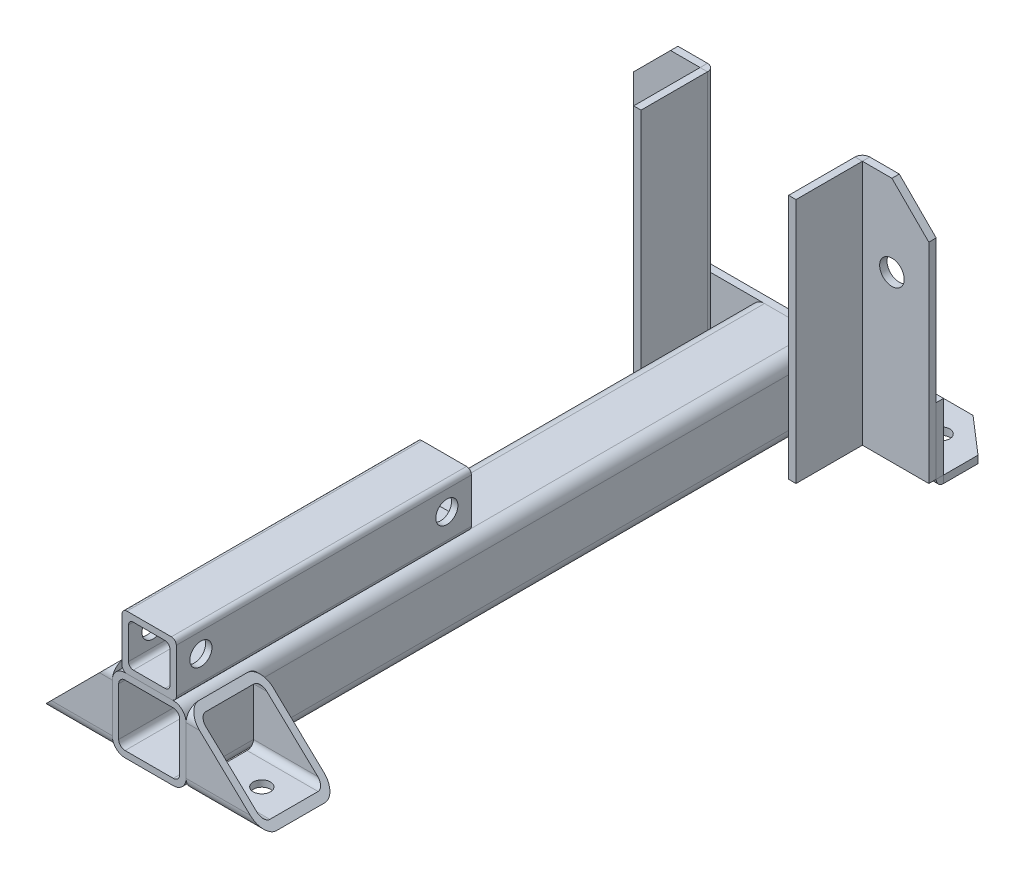
from build123d import *

# Parameters (mm, degrees)
SQUARE_TUBE_30_X_30_X_2_6_1_DEPTH   = 260
SQUARE_TUBE_30_X_30_X_2_6_1_2_DEPTH = 120
SKETCH2_R                           = 4.5
CUT_EXTRUDE1_DEPTH                  = 69
SQUARE_TUBE_30_X_30_X_2_6_4_DEPTH   = 30
CUT_EXTRUDE2_DEPTH                  = 69
SQUARE_TUBE_30_X_30_X_2_6_5_DEPTH   = 31.609427342
CUT_EXTRUDE3_DEPTH                  = 69
SKETCH19_R                          = 3.5
CUT_EXTRUDE6_DEPTH                  = 69
BASE_FLANGE4_START                  = -75
BASE_FLANGE4_DEPTH                  = 120
CUT_EXTRUDE7_DEPTH                  = 69
CUT_EXTRUDE7_DEPTH_BACK             = 302.577519056
SKETCH38_R                          = 3.5
BASE_FLANGE5_START                  = -27
BASE_FLANGE5_DEPTH                  = 100
BASE_FLANGE8_DEPTH                  = 100
SKETCH56_R                          = 5
CUT_EXTRUDE9_DEPTH                  = 69
CUT_EXTRUDE10_DEPTH                 = 69
CHAMFER2_SIZE                       = 15
SKETCH63_R                          = 5
CUT_EXTRUDE11_DEPTH                 = 69
SKETCH64_W                          = 22.06
SKETCH64_H                          = 22.06
SKETCH64_W_2                        = 16.86
SKETCH64_H_2                        = 16.86
BOSS_EXTRUDE1_DEPTH                 = 120
FILLET2_R                           = 2
FILLET3_R                           = 2
SKETCH65_R                          = 4.5
CUT_EXTRUDE12_DEPTH                 = 120


# Read off the part's stored shape, not the designer's step: Base-Flange4, Base-Flange5, Base-Flange8
with BuildPart() as part:
    # Sketch1 → Square tube 30 X 30 X 2.6(1) (new body)
    with BuildSketch(Plane(origin=(0, 0, 0), x_dir=(1, 0, 0), z_dir=(0, 0, -1))):
        with BuildLine():
            Line((-9.8, -15), (9.8, -15))
            ThreePointArc((9.8, -15), (13.476955262, -13.476955262), (15, -9.8))
            Line((15, -9.8), (15, 9.8))
            ThreePointArc((15, 9.8), (13.476955262, 13.476955262), (9.8, 15))
            Line((9.8, 15), (-9.8, 15))
            ThreePointArc((-9.8, 15), (-13.476955262, 13.476955262), (-15, 9.8))
            Line((-15, 9.8), (-15, -9.8))
            ThreePointArc((-15, -9.8), (-13.476955262, -13.476955262), (-9.8, -15))
        make_face()
        with BuildLine():
            Line((-9.8, -12.4), (9.8, -12.4))
            ThreePointArc((9.8, -12.4), (11.638477631, -11.638477631), (12.4, -9.8))
            Line((12.4, -9.8), (12.4, 9.8))
            ThreePointArc((12.4, 9.8), (11.638477631, 11.638477631), (9.8, 12.4))
            Line((9.8, 12.4), (-9.8, 12.4))
            ThreePointArc((-9.8, 12.4), (-11.638477631, 11.638477631), (-12.4, 9.8))
            Line((-12.4, 9.8), (-12.4, -9.8))
            ThreePointArc((-12.4, -9.8), (-11.638477631, -11.638477631), (-9.8, -12.4))
        make_face(mode=Mode.SUBTRACT)
    extrude(amount=SQUARE_TUBE_30_X_30_X_2_6_1_DEPTH)


with BuildPart() as body_2:
    # Sketch1 on segment 2 (carried to segment 2) → Square tube 30 X 30 X 2.6_1 2 (new body)
    with BuildSketch(Plane(origin=(0, 30, 0), x_dir=(1, 0, 0), z_dir=(0, 0, -1))):
        with BuildLine():
            Line((-9.8, -15), (9.8, -15))
            ThreePointArc((9.8, -15), (13.476955262, -13.476955262), (15, -9.8))
            Line((15, -9.8), (15, 9.8))
            ThreePointArc((15, 9.8), (13.476955262, 13.476955262), (9.8, 15))
            Line((9.8, 15), (-9.8, 15))
            ThreePointArc((-9.8, 15), (-13.476955262, 13.476955262), (-15, 9.8))
            Line((-15, 9.8), (-15, -9.8))
            ThreePointArc((-15, -9.8), (-13.476955262, -13.476955262), (-9.8, -15))
        make_face()
        with BuildLine():
            Line((-9.8, -12.4), (9.8, -12.4))
            ThreePointArc((9.8, -12.4), (11.638477631, -11.638477631), (12.4, -9.8))
            Line((12.4, -9.8), (12.4, 9.8))
            ThreePointArc((12.4, 9.8), (11.638477631, 11.638477631), (9.8, 12.4))
            Line((9.8, 12.4), (-9.8, 12.4))
            ThreePointArc((-9.8, 12.4), (-11.638477631, 11.638477631), (-12.4, 9.8))
            Line((-12.4, 9.8), (-12.4, -9.8))
            ThreePointArc((-12.4, -9.8), (-11.638477631, -11.638477631), (-9.8, -12.4))
        make_face(mode=Mode.SUBTRACT)
    extrude(amount=SQUARE_TUBE_30_X_30_X_2_6_1_2_DEPTH)

    # Sketch2 → Cut-Extrude1 (cut)
    with BuildSketch(Plane.ZY.offset(15)):
        with Locations((-110, 35)):
            Circle(SKETCH2_R)
        with Locations((-10, 35)):
            Circle(SKETCH2_R)
    extrude(amount=-CUT_EXTRUDE1_DEPTH, mode=Mode.SUBTRACT)


with BuildPart() as body_3:
    # Sketch11 → Square tube 30 X 30 X 2.6(4) (new body)
    with BuildSketch(Plane(origin=(-15, 0, -15), x_dir=(0, 0, 1), z_dir=(-1, 0, 0))):
        with BuildLine():
            Line((-9.8, -15), (9.8, -15))
            ThreePointArc((9.8, -15), (13.476955262, -13.476955262), (15, -9.8))
            Line((15, -9.8), (15, 9.8))
            ThreePointArc((15, 9.8), (13.476955262, 13.476955262), (9.8, 15))
            Line((9.8, 15), (-9.8, 15))
            ThreePointArc((-9.8, 15), (-13.476955262, 13.476955262), (-15, 9.8))
            Line((-15, 9.8), (-15, -9.8))
            ThreePointArc((-15, -9.8), (-13.476955262, -13.476955262), (-9.8, -15))
        make_face()
        with BuildLine():
            Line((-9.8, -12.4), (9.8, -12.4))
            ThreePointArc((9.8, -12.4), (11.638477631, -11.638477631), (12.4, -9.8))
            Line((12.4, -9.8), (12.4, 9.8))
            ThreePointArc((12.4, 9.8), (11.638477631, 11.638477631), (9.8, 12.4))
            Line((9.8, 12.4), (-9.8, 12.4))
            ThreePointArc((-9.8, 12.4), (-11.638477631, 11.638477631), (-12.4, 9.8))
            Line((-12.4, 9.8), (-12.4, -9.8))
            ThreePointArc((-12.4, -9.8), (-11.638477631, -11.638477631), (-9.8, -12.4))
        make_face(mode=Mode.SUBTRACT)
    extrude(amount=SQUARE_TUBE_30_X_30_X_2_6_4_DEPTH)

    # Sketch15 → Cut-Extrude2 (cut)
    with BuildSketch(Plane.XY):
        Polygon((-15, 15), (-45, -15), (-45, 15), align=None)
    extrude(amount=-CUT_EXTRUDE2_DEPTH, mode=Mode.SUBTRACT)


with BuildPart() as body_4:
    # Sketch12 → Square tube 30 X 30 X 2.6(5) (new body)
    with BuildSketch(Plane(origin=(15, 0, -15), x_dir=(0, 0, -1), z_dir=(1, 0, 0))):
        with BuildLine():
            Line((-9.8, -15), (9.8, -15))
            ThreePointArc((9.8, -15), (13.476955262, -13.476955262), (15, -9.8))
            Line((15, -9.8), (15, 9.8))
            ThreePointArc((15, 9.8), (13.476955262, 13.476955262), (9.8, 15))
            Line((9.8, 15), (-9.8, 15))
            ThreePointArc((-9.8, 15), (-13.476955262, 13.476955262), (-15, 9.8))
            Line((-15, 9.8), (-15, -9.8))
            ThreePointArc((-15, -9.8), (-13.476955262, -13.476955262), (-9.8, -15))
        make_face()
        with BuildLine():
            Line((-9.8, -12.4), (9.8, -12.4))
            ThreePointArc((9.8, -12.4), (11.638477631, -11.638477631), (12.4, -9.8))
            Line((12.4, -9.8), (12.4, 9.8))
            ThreePointArc((12.4, 9.8), (11.638477631, 11.638477631), (9.8, 12.4))
            Line((9.8, 12.4), (-9.8, 12.4))
            ThreePointArc((-9.8, 12.4), (-11.638477631, 11.638477631), (-12.4, 9.8))
            Line((-12.4, 9.8), (-12.4, -9.8))
            ThreePointArc((-12.4, -9.8), (-11.638477631, -11.638477631), (-9.8, -12.4))
        make_face(mode=Mode.SUBTRACT)
    extrude(amount=SQUARE_TUBE_30_X_30_X_2_6_5_DEPTH)

    # Sketch16 → Cut-Extrude3 (cut)
    with BuildSketch(Plane.XY):
        Polygon((46.609427342, -15), (46.609427342, 15), (15, 15), align=None)
    extrude(amount=-CUT_EXTRUDE3_DEPTH, mode=Mode.SUBTRACT)


with BuildPart() as cut_extrude6_tool:
    # Sketch19 → Cut-Extrude6 (new body)
    with BuildSketch(Plane(origin=(0, -9.8, 0), x_dir=(-1, 0, 0), z_dir=(0, -1, 0))):
        with Locations((30, 15)):
            Circle(SKETCH19_R)
        with Locations((-30.804713671, 15)):
            Circle(SKETCH19_R)
    extrude(amount=CUT_EXTRUDE6_DEPTH)


with BuildPart() as body_3_1:
    add(body_3.part)

    # Cut-Extrude6: cut by cut_extrude6_tool
    add(cut_extrude6_tool.part, mode=Mode.SUBTRACT)


with BuildPart() as body_4_1:
    add(body_4.part)

    # Cut-Extrude6: cut by cut_extrude6_tool
    add(cut_extrude6_tool.part, mode=Mode.SUBTRACT)


with BuildPart() as body_5:
    # Base-Flange4 outline → Base-Flange4 (new body)
    with BuildSketch(Plane.ZY.offset(15).offset(BASE_FLANGE4_START)):
        with BuildLine():
            Line((-263, -12), (-290, -12))
            Line((-290, -12), (-290, -15))
            Line((-290, -15), (-263, -15))
            ThreePointArc((-263, -15), (-260.878679656, -14.121320344), (-260, -12))
            Line((-260, -12), (-260, 15))
            Line((-260, 15), (-263, 15))
            Line((-263, 15), (-263, -12))
        make_face()
    extrude(amount=BASE_FLANGE4_DEPTH)

    # Sketch38 → Cut-Extrude7 (cut, two sides: drawn at the far end of the back side and taken through both)
    with BuildSketch(Plane(origin=(0, -12, 0), x_dir=(1, 0, 0), z_dir=(0, 1, 0)).offset(-CUT_EXTRUDE7_DEPTH_BACK)):
        with Locations(Location((45, 277, 0), (0, 0, 270))):
            Circle(SKETCH38_R)
        with Locations(Location((-45, 277, 0), (0, 0, 270))):
            Circle(SKETCH38_R)
        Polygon((60, 277), (45, 290), (60, 290), align=None)
        Polygon((-60, 277), (-45, 290), (-60, 290), align=None)
    extrude(amount=CUT_EXTRUDE7_DEPTH + CUT_EXTRUDE7_DEPTH_BACK, mode=Mode.SUBTRACT)


with BuildPart() as body_6:
    # Base-Flange5 outline → Base-Flange5 (new body)
    with BuildSketch(Plane(origin=(0, 15, 0), x_dir=(1, 0, 0), z_dir=(0, 1, 0)).offset(BASE_FLANGE5_START)):
        with BuildLine():
            Line((-60, 257), (-33, 257))
            Line((-33, 257), (-33, 230))
            Line((-33, 230), (-30, 230))
            Line((-30, 230), (-30, 257))
            ThreePointArc((-30, 257), (-30.878679656, 259.121320344), (-33, 260))
            Line((-33, 260), (-60, 260))
            Line((-60, 260), (-60, 257))
        make_face()
    extrude(amount=BASE_FLANGE5_DEPTH)

    # Sketch56 → Cut-Extrude9 (cut)
    with BuildSketch(Plane(origin=(0, 0, -260), x_dir=(-1, 0, 0), z_dir=(0, 0, -1))):
        with Locations((45, 54.89)):
            Circle(SKETCH56_R)
    extrude(amount=-CUT_EXTRUDE9_DEPTH, mode=Mode.SUBTRACT)

    # Sketch62 → Cut-Extrude10 (cut)
    with BuildSketch(Plane(origin=(0, 0, -260), x_dir=(-1, 0, 0), z_dir=(0, 0, -1))):
        Polygon((45, 88), (60, 73), (60, 88), align=None)
    extrude(amount=-CUT_EXTRUDE10_DEPTH, mode=Mode.SUBTRACT)


with BuildPart() as body_7:
    # Base-Flange8 outline → Base-Flange8 (new body)
    with BuildSketch(Plane(origin=(0, -12, 0), x_dir=(1, 0, 0), z_dir=(0, 1, 0))):
        with BuildLine():
            Line((30, 257), (30, 230))
            Line((30, 230), (33, 230))
            Line((33, 230), (33, 257))
            Line((33, 257), (60, 257))
            Line((60, 257), (60, 260))
            Line((60, 260), (33, 260))
            ThreePointArc((33, 260), (30.878679656, 259.121320344), (30, 257))
        make_face()
    extrude(amount=BASE_FLANGE8_DEPTH)

    # Chamfer2
    chamfer2_edges = [body_7.edges().sort_by_distance(p)[0] for p in [
        (60, 88, -258.5),
    ]]
    chamfer(chamfer2_edges, length=CHAMFER2_SIZE)

    # Sketch63 → Cut-Extrude11 (cut)
    with BuildSketch(Plane(origin=(0, 0, -260), x_dir=(-1, 0, 0), z_dir=(0, 0, -1))):
        with Locations((-45, 54.89)):
            Circle(SKETCH63_R)
    extrude(amount=-CUT_EXTRUDE11_DEPTH, mode=Mode.SUBTRACT)


with BuildPart() as body_7_2:
    # Sketch64 → Boss-Extrude1 (new body)
    with BuildSketch(Plane.XY):
        with Locations((0, 26.03)):
            Rectangle(SKETCH64_W, SKETCH64_H)
        with Locations((0, 26.03)):
            Rectangle(SKETCH64_W_2, SKETCH64_H_2, mode=Mode.SUBTRACT)
    extrude(amount=-BOSS_EXTRUDE1_DEPTH)

    # Fillet2
    fillet2_edges = [body_7_2.edges().sort_by_distance(p)[0] for p in [
        (-11.03, 37.06, -60),
        (11.03, 37.06, -60),
        (11.03, 15, -60),
        (-11.03, 15, -60),
    ]]
    fillet(fillet2_edges, radius=FILLET2_R)

    # Fillet3
    fillet3_edges = [body_7_2.edges().sort_by_distance(p)[0] for p in [
        (-8.43, 17.6, -60),
        (-8.43, 34.46, -60),
        (8.43, 34.46, -60),
        (8.43, 17.6, -60),
    ]]
    fillet(fillet3_edges, radius=FILLET3_R)

    # Sketch65 → Cut-Extrude12 (cut)
    with BuildSketch(Plane(origin=(11.03, 0, 0), x_dir=(0, 0, -1), z_dir=(1, 0, 0))):
        with Locations((110, 27.06)):
            Circle(SKETCH65_R)
        with Locations((10, 27.06)):
            Circle(SKETCH65_R)
    extrude(amount=-CUT_EXTRUDE12_DEPTH, mode=Mode.SUBTRACT)


solid = Compound([part.part, body_3_1.part, body_4_1.part, body_5.part, body_6.part, body_7.part, body_7_2.part])
